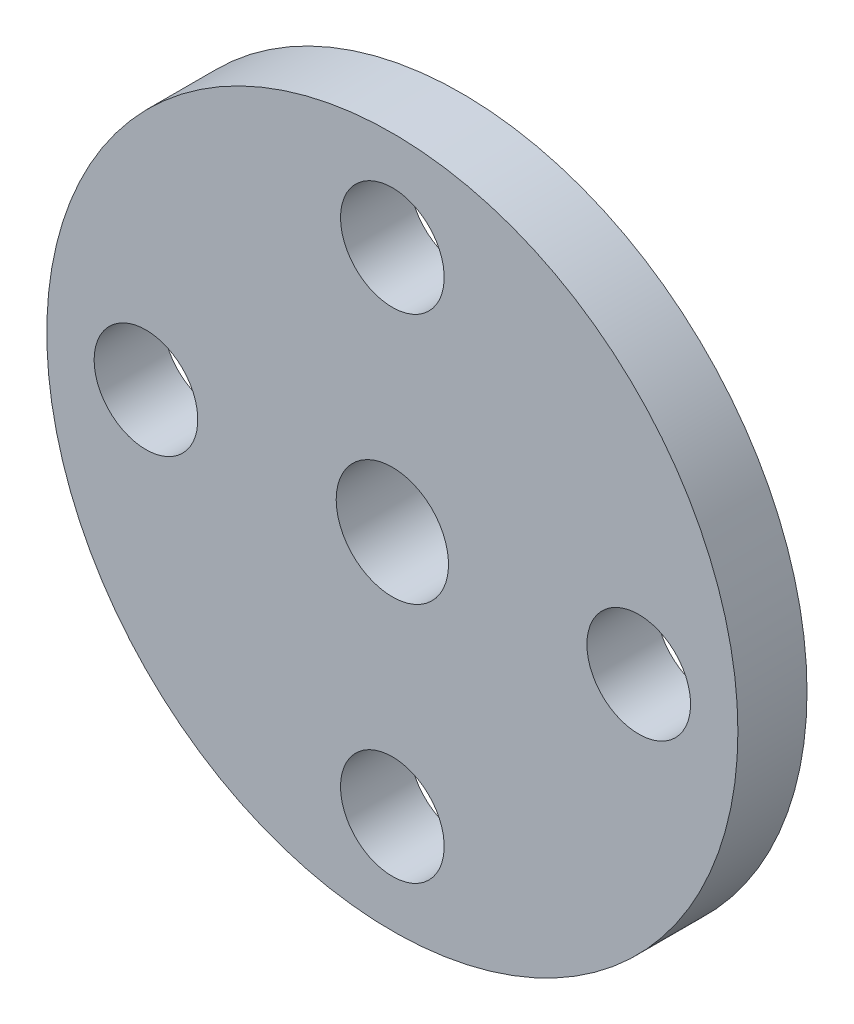
from build123d import *

# Parameters (mm, degrees)
SCHIZZO14_R                  = 10
ESTRUSIONE_ESTRUSIONE2_DEPTH = 2
FORO_3_0_3_1_D               = 3
SCHIZZO19_R                  = 4.5
ESTRUSIONE_ESTRUSIONE3_DEPTH = 2
SCHIZZO20_R                  = 1.625
TAGLIO_ESTRUSIONE1_DEPTH     = 15.696938457


with BuildPart() as part:
    # Schizzo14 → Estrusione-Estrusione2 (new body)
    with BuildSketch(Plane.XY):
        Circle(SCHIZZO14_R)
    extrude(amount=ESTRUSIONE_ESTRUSIONE2_DEPTH)

    # Foro Ø3.0 (3)-1 (through all)
    with Locations(Plane(origin=(7.13, 0, 0), x_dir=(-1, 0, 0), z_dir=(0, 0, -1))):
        with Locations((0, 0), (14.26, 0), (7.13, -7.13), (7.13, 7.13)):
            Hole(FORO_3_0_3_1_D / 2)

    # Schizzo19 → Estrusione-Estrusione3 (add)
    with BuildSketch(Plane.XY):
        Circle(SCHIZZO19_R)
    extrude(amount=-ESTRUSIONE_ESTRUSIONE3_DEPTH)

    # Schizzo20 → Taglio-Estrusione1 (cut, through all)
    with BuildSketch(Plane(origin=(0, 0, -2), x_dir=(-1, 0, 0), z_dir=(0, 0, -1))):
        Circle(SCHIZZO20_R)
    extrude(amount=-TAGLIO_ESTRUSIONE1_DEPTH, mode=Mode.SUBTRACT)


solid = part.part
